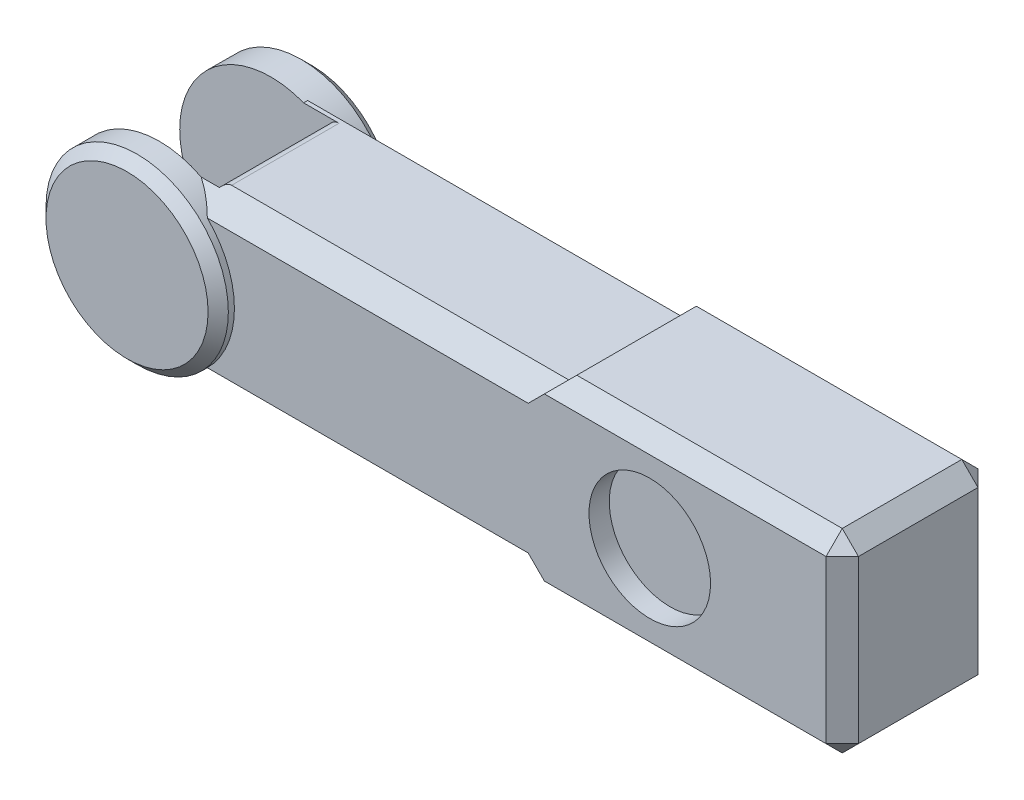
from build123d import *

# Parameters (mm, degrees)
BOSS_EXTRU_1_DEPTH = 75
SKETCH3_R          = 30
CUT_EXTRUDE3_DEPTH = 10
ESQUISSE2_R        = 45
BOSS_EXTRU_2_DEPTH = 8
CHANFREIN1_SIZE    = 5
BOSS_EXTRU_3_START = 8
ESQUISSE3_R        = 45
BOSS_EXTRU_3_DEPTH = 8
CHANFREIN2_SIZE    = 5
D_POUILLE5_ANGLE   = 45
D_POUILLE6_ANGLE   = 45
CHANFREIN4_SIZE    = 10
SKETCH2_R          = 45
CUT_EXTRUDE2_DEPTH = 55
FILLET1_R          = 5
CHAMFER1_SIZE      = 8


with BuildPart() as part:
    # Esquisse1 → Boss.-Extru.1 (new body)
    with BuildSketch(Plane.XY):
        with BuildLine():
            Line((95, -48), (95, 48))
            Line((95, 48), (-50, 48))
            Line((-50, 48), (-50, 42))
            Line((-50, 42), (-233.844505579, 42))
            ThreePointArc((-233.844505579, 42), (-295, 0), (-233.844505579, -42))
            Line((-233.844505579, -42), (-50, -42))
            Line((-50, -42), (-50, -48))
            Line((-50, -48), (95, -48))
        make_face()
    extrude(amount=BOSS_EXTRU_1_DEPTH)

    # Sketch3 → Cut-Extrude3 (cut)
    with BuildSketch(Plane.XY.offset(75)):
        Circle(SKETCH3_R)
    extrude(amount=-CUT_EXTRUDE3_DEPTH, mode=Mode.SUBTRACT)

    # Esquisse2 → Boss.-Extru.2 (add)
    with BuildSketch(Plane.XY.offset(75)):
        with Locations(Location((-250, 0, 0), (0, 0, 68.960530219))):
            Circle(ESQUISSE2_R)
    extrude(amount=BOSS_EXTRU_2_DEPTH)

    # Chanfrein1
    chanfrein1_edges = [part.edges().sort_by_distance(p)[0] for p in [
        (-266.155494421, -42, 83),
    ]]
    chamfer(chanfrein1_edges, length=CHANFREIN1_SIZE)

    # Esquisse3 → Boss.-Extru.3 (add)
    with BuildSketch(Plane(origin=(0, 0, 0), x_dir=(-1, 0, 0), z_dir=(0, 0, -1)).offset(BOSS_EXTRU_3_START)):
        with Locations((250, 0)):
            Circle(ESQUISSE3_R)
    extrude(amount=-BOSS_EXTRU_3_DEPTH)

    # Chanfrein2
    chanfrein2_edges = [part.edges().sort_by_distance(p)[0] for p in [
        (-205, 0, -8),
    ]]
    chamfer(chanfrein2_edges, length=CHANFREIN2_SIZE)

    # Dépouille5
    d_pouille5_faces = [part.faces().sort_by_distance(p)[0] for p in [
        (-50, 45, 37.5),
    ]]
    draft(d_pouille5_faces, Plane(origin=(-50, 42, 75), x_dir=(1, 0, 0), z_dir=(0, 1, 0)), D_POUILLE5_ANGLE)

    # Dépouille6
    d_pouille6_faces = [part.faces().sort_by_distance(p)[0] for p in [
        (-50, -45, 37.5),
    ]]
    draft(d_pouille6_faces, Plane(origin=(-50, -42, 75), x_dir=(-1, 0, 0), z_dir=(0, -1, 0)), D_POUILLE6_ANGLE)

    # Chanfrein4
    # the kernel refuses this chamfer: 10 mm, written as the material it takes off along each edge
    with BuildSketch(Plane(origin=(-259.561335458, -42, 75), x_dir=(0, -0.027495876610586317, -0.9996219169112968), z_dir=(1, 0, 0))) as chanfrein4_piece_1_section:
        Polygon((CHANFREIN4_SIZE * 0.999621916911, CHANFREIN4_SIZE * 0.0274958766106), (-CHANFREIN4_SIZE * 0.0274958766106, CHANFREIN4_SIZE * 0.999621916911), (0, 0), align=None)
    chanfrein4_piece_1 = extrude(amount=235.278165338, mode=Mode.PRIVATE)
    chanfrein4_piece_1 = chanfrein4_piece_1 - Plane(origin=(-250, 0, 71.650306889), x_dir=(0.35901098714230106, 0.9333333333333331, 0), z_dir=(0, 0, -1)) * Cylinder(45, 511, mode=Mode.PRIVATE)
    chanfrein4_piece_1 = split(chanfrein4_piece_1, bisect_by=Plane(origin=(-96.832103128, 4.832103128, 71.650306889), z_dir=(-0.7071067811865462, -0.7071067811865488, 0)), keep=Keep.TOP, mode=Mode.PRIVATE)
    add(chanfrein4_piece_1, mode=Mode.SUBTRACT)
    with BuildSketch(Plane(origin=(-259.561335458, -42, 0), x_dir=(0, 0.9996219169112968, -0.027495876610586372), z_dir=(1, 0, 0))) as chanfrein4_piece_2_section:
        Polygon((CHANFREIN4_SIZE * 0.999621916911, CHANFREIN4_SIZE * 0.0274958766106), (-CHANFREIN4_SIZE * 0.0274958766106, CHANFREIN4_SIZE * 0.999621916911), (0, 0), align=None)
    chanfrein4_piece_2 = extrude(amount=235.278165338, mode=Mode.PRIVATE)
    chanfrein4_piece_2 = chanfrein4_piece_2 - Plane(origin=(-250, 0, 3.349693111), x_dir=(-1, 0, 0), z_dir=(0, 0, -1)) * Cylinder(45, 511, mode=Mode.PRIVATE)
    chanfrein4_piece_2 = split(chanfrein4_piece_2, bisect_by=Plane(origin=(-96.832103062, 4.832103062, 3.349693111), z_dir=(-0.7071067811865462, -0.7071067811865488, 0)), keep=Keep.TOP, mode=Mode.PRIVATE)
    add(chanfrein4_piece_2, mode=Mode.SUBTRACT)
    with BuildSketch(Plane(origin=(-24.28317012, 42, 0), x_dir=(0, -0.9996219169112968, -0.027495876610586372), z_dir=(-1, 0, 0))) as chanfrein4_piece_3_section:
        Polygon((CHANFREIN4_SIZE * 0.999621916911, CHANFREIN4_SIZE * 0.0274958766106), (-CHANFREIN4_SIZE * 0.0274958766106, CHANFREIN4_SIZE * 0.999621916911), (0, 0), align=None)
    chanfrein4_piece_3 = extrude(amount=235.278165338, mode=Mode.PRIVATE)
    chanfrein4_piece_3 = chanfrein4_piece_3 - Plane(origin=(-250, 0, 3.349693112), x_dir=(-1, 0, 0), z_dir=(0, 0, -1)) * Cylinder(45, 511, mode=Mode.PRIVATE)
    chanfrein4_piece_3 = split(chanfrein4_piece_3, bisect_by=Plane(origin=(-96.832103108, -4.832103108, 3.349693112), z_dir=(-0.7071067811865462, 0.7071067811865488, 0)), keep=Keep.TOP, mode=Mode.PRIVATE)
    add(chanfrein4_piece_3, mode=Mode.SUBTRACT)
    with BuildSketch(Plane(origin=(-24.28317012, 42, 75), x_dir=(0, 0.027495876610586317, -0.9996219169112968), z_dir=(-1, 0, 0))) as chanfrein4_piece_4_section:
        Polygon((CHANFREIN4_SIZE * 0.999621916911, CHANFREIN4_SIZE * 0.0274958766106), (-CHANFREIN4_SIZE * 0.0274958766106, CHANFREIN4_SIZE * 0.999621916911), (0, 0), align=None)
    chanfrein4_piece_4 = extrude(amount=235.278165338, mode=Mode.PRIVATE)
    chanfrein4_piece_4 = chanfrein4_piece_4 - Plane(origin=(-250, 0, 71.65030689), x_dir=(0.35901098714230106, 0.9333333333333331, 0), z_dir=(0, 0, -1)) * Cylinder(45, 511, mode=Mode.PRIVATE)
    chanfrein4_piece_4 = split(chanfrein4_piece_4, bisect_by=Plane(origin=(-96.832103072, -4.832103072, 71.65030689), z_dir=(-0.7071067811865462, 0.7071067811865488, 0)), keep=Keep.TOP, mode=Mode.PRIVATE)
    add(chanfrein4_piece_4, mode=Mode.SUBTRACT)

    # Sketch2 → Cut-Extrude2 (cut)
    with BuildSketch(Plane(origin=(0, 0, 12), x_dir=(-1, 0, 0), z_dir=(0, 0, -1))):
        with Locations(Location((250, 0, 0), (0, 0, 242.733955549))):
            Circle(SKETCH2_R)
    extrude(amount=-CUT_EXTRUDE2_DEPTH, mode=Mode.SUBTRACT)

    # Fillet1
    # the kernel refuses this fillet: 5 mm, written as the material it takes off along each edge
    with BuildSketch(Plane(origin=(-233.844505579, -42, 12), x_dir=(0.8512324625883901, 0.5247888095564778, 0), z_dir=(0, 0, 1))) as fillet1_piece_1_section:
        with BuildLine():
            CenterArc((17.499102813, -4.914442902), FILLET1_R, 100.614557324, 137.73141557)
            Line((14.875158765, -9.170605214), (0, 0))
            ThreePointArc((0, 0), (8.289048701, -0.770013886), (16.578097401, 0))
        make_face()
    fillet1_piece_1 = extrude(amount=96.68712255, mode=Mode.PRIVATE)
    fillet1_piece_1 = split(fillet1_piece_1, bisect_by=Plane(origin=(-224.59334288, -39.762552666, 67), z_dir=(0, 0, -1)), keep=Keep.TOP, mode=Mode.PRIVATE)
    add(fillet1_piece_1, mode=Mode.SUBTRACT)
    with BuildSketch(Plane(origin=(-233.844505579, 42, 12), x_dir=(0.8512324625883905, -0.5247888095564773, 0), z_dir=(0, 0, 1))) as fillet1_piece_2_section:
        with BuildLine():
            CenterArc((17.499102813, 4.914442902), FILLET1_R, 121.654027105, 137.73141557)
            Line((14.875158765, 9.170605214), (0, 0))
            ThreePointArc((0, 0), (8.289048701, 0.770013886), (16.578097401, 0))
        make_face()
    fillet1_piece_2 = extrude(amount=96.68712255, mode=Mode.PRIVATE)
    fillet1_piece_2 = split(fillet1_piece_2, bisect_by=Plane(origin=(-224.59334288, 39.762552666, 67), z_dir=(0, 0, -1)), keep=Keep.TOP, mode=Mode.PRIVATE)
    add(fillet1_piece_2, mode=Mode.SUBTRACT)

    # Chamfer1
    chamfer1_edges = [part.edges().sort_by_distance(p)[0] for p in [
        (25.5, 48, 0),
        (95, 48, 37.5),
        (95, -48, 37.5),
        (25.5, -48, 75),
        (95, 0, 75),
        (25.5, 48, 75),
        (95, 0, 0),
        (25.5, -48, 0),
    ]]
    chamfer(chamfer1_edges, length=CHAMFER1_SIZE)


solid = part.part
